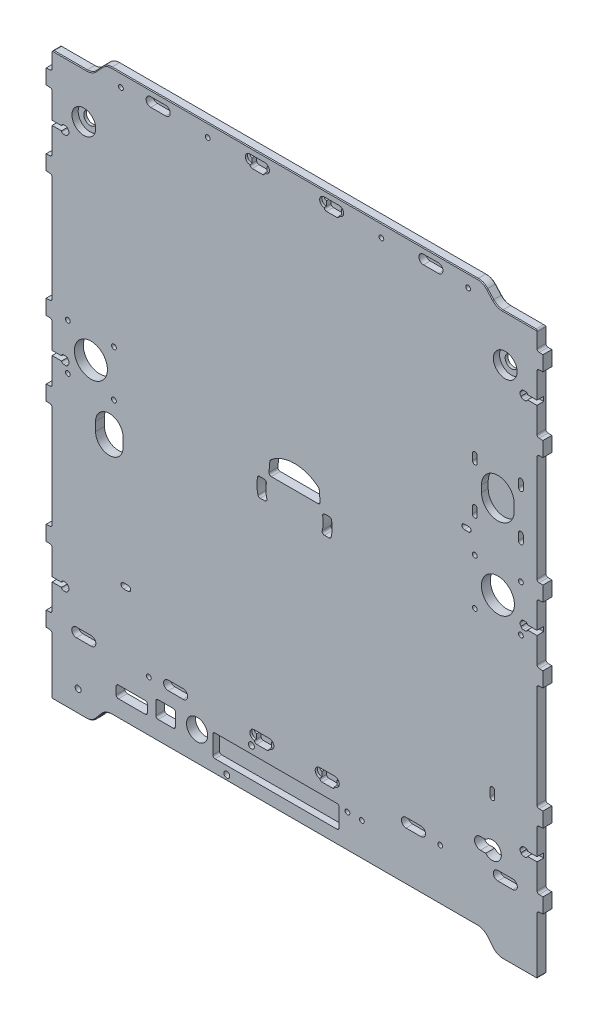
from build123d import *

# Parameters (mm, degrees)
CROQUIS1_W                                           = 334.2
CROQUIS1_H                                           = 388
SALIENTE_EXTRUIR1_DEPTH                              = 6
CORTAR_EXTRUIR1_DEPTH                                = 1.5
CORTAR_EXTRUIR2_DEPTH                                = 3
CORTAR_EXTRUIR3_DEPTH                                = 1.5
CORTAR_EXTRUIR4_DEPTH                                = 3
CROQUIS6_W                                           = 4
CROQUIS6_H                                           = 39.720633844
CORTAR_EXTRUIR5_DEPTH                                = 257.114056623
CROQUIS7_W                                           = 4
CROQUIS7_H                                           = 39.720633844
CORTAR_EXTRUIR6_DEPTH                                = 257.114056623
CROQUIS8_W                                           = 4
CROQUIS8_H                                           = 39.720633844
CORTAR_EXTRUIR7_DEPTH                                = 257.114056623
CORTAR_EXTRUIR8_DEPTH                                = 4.5
CORTAR_EXTRUIR9_DEPTH                                = 4.5
CORTAR_EXTRUIR10_DEPTH                               = 4.5
CROQUIS12_W                                          = 40.15222949
CROQUIS12_H                                          = 10
CORTAR_EXTRUIR11_DEPTH                               = 257.114056623
CROQUIS13_W                                          = 4
CROQUIS13_H                                          = 12.160316922
CORTAR_EXTRUIR12_DEPTH                               = 257.114056623
CROQUIS14_W                                          = 4
CROQUIS14_H                                          = 73.920633844
CORTAR_EXTRUIR13_DEPTH                               = 257.114056623
CROQUIS15_W                                          = 4
CROQUIS15_H                                          = 71.420633844
CORTAR_EXTRUIR14_DEPTH                               = 257.114056623
CROQUIS16_W                                          = 4
CROQUIS16_H                                          = 39.660316922
CORTAR_EXTRUIR15_DEPTH                               = 257.114056623
CROQUIS17_W                                          = 253.89554102
CROQUIS17_H                                          = 10.907202375
CORTAR_EXTRUIR16_DEPTH                               = 257.114056623
CROQUIS18_W                                          = 21
CROQUIS18_H                                          = 8
CORTAR_EXTRUIR17_DEPTH                               = 257.114056623
CROQUIS19_W                                          = 13.2
CROQUIS19_H                                          = 11.5
CORTAR_EXTRUIR18_DEPTH                               = 257.114056623
CORTAR_EXTRUIR19_DEPTH                               = 257.114056623
CORTAR_EXTRUIR20_DEPTH                               = 257.114056623
CORTAR_EXTRUIR21_DEPTH                               = 257.114056623
CORTAR_EXTRUIR22_DEPTH                               = 257.114056623
CORTAR_EXTRUIR23_DEPTH                               = 257.114056623
CORTAR_EXTRUIR24_DEPTH                               = 257.114056623
CORTAR_EXTRUIR25_DEPTH                               = 257.114056623
CORTAR_EXTRUIR26_DEPTH                               = 257.114056623
CORTAR_EXTRUIR27_DEPTH                               = 257.114056623
CORTAR_EXTRUIR28_DEPTH                               = 257.114056623
CORTAR_EXTRUIR29_DEPTH                               = 257.114056623
CORTAR_EXTRUIR30_DEPTH                               = 4.5
CORTAR_EXTRUIR31_DEPTH                               = 4.5
CORTAR_EXTRUIR32_DEPTH                               = 4.5
CORTAR_EXTRUIR33_DEPTH                               = 4.5
CROQUIS36_W                                          = 85
CROQUIS36_H                                          = 15
CORTAR_EXTRUIR34_DEPTH                               = 4.5
NGULO_DE_SALIDA1_ANGLE                               = 2
NGULO_DE_SALIDA2_ANGLE                               = 2
NGULO_DE_SALIDA3_ANGLE                               = 2
NGULO_DE_SALIDA4_ANGLE                               = 2
NGULO_DE_SALIDA5_ANGLE                               = 2
NGULO_DE_SALIDA6_ANGLE                               = 2
NGULO_DE_SALIDA7_ANGLE                               = 2
NGULO_DE_SALIDA8_ANGLE                               = 2
NGULO_DE_SALIDA9_ANGLE                               = 2
NGULO_DE_SALIDA10_ANGLE                              = 2
NGULO_DE_SALIDA11_ANGLE                              = 2
NGULO_DE_SALIDA12_ANGLE                              = 42.465465587
NGULO_DE_SALIDA13_ANGLE                              = 2
NGULO_DE_SALIDA14_ANGLE                              = 2
NGULO_DE_SALIDA15_ANGLE                              = 2
NGULO_DE_SALIDA16_ANGLE                              = 40
CROQUIS37_W                                          = 6
CROQUIS37_H                                          = 6
TALADRO_DE_MARGEN_PARA_M121_D                        = 14.3
TALADRO_DE_MARGEN_PARA_M201_D                        = 22.2
DI_METRO_DE_TALADRO_3_2_3_2_1_D                      = 3.2
DI_METRO_DE_TALADRO_3_2_3_2_2_D                      = 3.2
DI_METRO_DE_TALADRO_4_0_4_1_D                        = 4
DI_METRO_DE_TALADRO_4_0_4_1_DEPTH                    = 4.5
REFRENTADO_PARA_PERNO_CON_CABEZA_HEXAGON_D           = 8.5
REFRENTADO_PARA_PERNO_CON_CABEZA_HEXAGON_CBORE_D     = 16
REFRENTADO_PARA_PERNO_CON_CABEZA_HEXAGON_CBORE_DEPTH = 4.2
REDONDEO1_R                                          = 8.5
CHAFL_N1_SIZE                                        = 0.5
REDONDEO2_R                                          = 1
REDONDEO3_R                                          = 1.5


with BuildPart() as part:
    # Croquis1 → Saliente-Extruir1 (new body)
    with BuildSketch(Plane.XY.offset(3)):
        Rectangle(CROQUIS1_W, CROQUIS1_H)
    extrude(amount=-SALIENTE_EXTRUIR1_DEPTH)

    # Croquis2 → Cortar-Extruir1 (cut)
    with BuildSketch(Plane.XY.offset(3)):
        with BuildLine():
            Line((-17, -151.6), (-17, -150.1))
            ThreePointArc((-17, -150.1), (-13.9, -147), (-17, -143.9))
            Line((-17, -143.9), (-27, -143.9))
            ThreePointArc((-27, -143.9), (-30.1, -147), (-27, -150.1))
            Line((-27, -150.1), (-27, -151.6))
            Line((-27, -151.6), (-17, -151.6))
        make_face()
    cortar_extruir1 = extrude(amount=-CORTAR_EXTRUIR1_DEPTH, mode=Mode.SUBTRACT)

    # Croquis3 → Cortar-Extruir2 (cut)
    with BuildSketch(Plane.XY.offset(1.5)):
        with BuildLine():
            Line((-17, -143.9), (-27, -143.9))
            ThreePointArc((-27, -143.9), (-28.5, -145.4), (-27, -146.9))
            Line((-27, -146.9), (-27, -151.6))
            Line((-27, -151.6), (-17, -151.6))
            Line((-17, -151.6), (-17, -146.9))
            ThreePointArc((-17, -146.9), (-15.5, -145.4), (-17, -143.9))
        make_face()
    cortar_extruir2 = extrude(amount=-CORTAR_EXTRUIR2_DEPTH, mode=Mode.SUBTRACT)

    # Croquis4 → Cortar-Extruir3 (cut)
    with BuildSketch(Plane.XY.offset(3)):
        with BuildLine():
            Line((-20, 182.4), (-20, 183.9))
            ThreePointArc((-20, 183.9), (-16.9, 187), (-20, 190.1))
            Line((-20, 190.1), (-30, 190.1))
            ThreePointArc((-30, 190.1), (-33.1, 187), (-30, 183.9))
            Line((-30, 183.9), (-30, 182.4))
            Line((-30, 182.4), (-20, 182.4))
        make_face()
    cortar_extruir3 = extrude(amount=-CORTAR_EXTRUIR3_DEPTH, mode=Mode.SUBTRACT)

    # Croquis5 → Cortar-Extruir4 (cut)
    with BuildSketch(Plane.XY.offset(1.5)):
        with BuildLine():
            Line((-30, 187.1), (-30, 182.4))
            Line((-30, 182.4), (-20, 182.4))
            Line((-20, 182.4), (-20, 187.1))
            ThreePointArc((-20, 187.1), (-18.5, 188.6), (-20, 190.1))
            Line((-20, 190.1), (-30, 190.1))
            ThreePointArc((-30, 190.1), (-31.5, 188.6), (-30, 187.1))
        make_face()
    cortar_extruir4 = extrude(amount=-CORTAR_EXTRUIR4_DEPTH, mode=Mode.SUBTRACT)

    # Croquis6 → Cortar-Extruir5 (cut, through all)
    with BuildSketch(Plane(origin=(0, 0, -3), x_dir=(-1, 0, 0), z_dir=(0, 0, -1))):
        with Locations((165.1, 141.7)):
            Rectangle(CROQUIS6_W, CROQUIS6_H)
    cortar_extruir5 = extrude(amount=-CORTAR_EXTRUIR5_DEPTH, mode=Mode.SUBTRACT)

    # Croquis7 → Cortar-Extruir6 (cut, through all)
    with BuildSketch(Plane(origin=(0, 0, -3), x_dir=(-1, 0, 0), z_dir=(0, 0, -1))):
        with Locations((165.1, 7.5)):
            Rectangle(CROQUIS7_W, CROQUIS7_H)
    cortar_extruir6 = extrude(amount=-CORTAR_EXTRUIR6_DEPTH, mode=Mode.SUBTRACT)

    # Croquis8 → Cortar-Extruir7 (cut, through all)
    with BuildSketch(Plane(origin=(0, 0, -3), x_dir=(-1, 0, 0), z_dir=(0, 0, -1))):
        with Locations((165.1, -124.2)):
            Rectangle(CROQUIS8_W, CROQUIS8_H)
    cortar_extruir7 = extrude(amount=-CORTAR_EXTRUIR7_DEPTH, mode=Mode.SUBTRACT)

    # Croquis9 → Cortar-Extruir8 (cut)
    with BuildSketch(Plane.XY.offset(3)):
        with BuildLine():
            Line((-163.1, -125.8), (-156.779019946, -125.8))
            ThreePointArc((-156.779019946, -125.8), (-156.268245837, -126.695643924), (-155.3, -127.05))
            Line((-155.3, -127.05), (-153.9, -127.05))
            ThreePointArc((-153.9, -127.05), (-152.931754163, -126.695643924), (-152.420980054, -125.8))
            Line((-152.420980054, -125.8), (-152.420980054, -125.637509594))
            ThreePointArc((-152.420980054, -125.637509594), (-151.6, -124.3), (-152.420980054, -122.962490406))
            Line((-152.420980054, -122.962490406), (-152.420980054, -122.8))
            ThreePointArc((-152.420980054, -122.8), (-152.931754163, -121.904356076), (-153.9, -121.55))
            Line((-153.9, -121.55), (-155.3, -121.55))
            ThreePointArc((-155.3, -121.55), (-156.268245837, -121.904356076), (-156.779019946, -122.8))
            Line((-156.779019946, -122.8), (-163.1, -122.8))
            Line((-163.1, -122.8), (-163.1, -125.8))
        make_face()
    cortar_extruir8 = extrude(amount=-CORTAR_EXTRUIR8_DEPTH, mode=Mode.SUBTRACT)

    # Croquis10 → Cortar-Extruir9 (cut)
    with BuildSketch(Plane.XY.offset(3)):
        with BuildLine():
            Line((-163.1, 6.1), (-156.779454737, 6.1))
            ThreePointArc((-156.779454737, 6.1), (-156.268680627, 5.204356076), (-155.300434791, 4.85))
            Line((-155.300434791, 4.85), (-153.900434791, 4.85))
            ThreePointArc((-153.900434791, 4.85), (-152.932188954, 5.204356076), (-152.421414845, 6.1))
            Line((-152.421414845, 6.1), (-152.421414845, 6.262490406))
            ThreePointArc((-152.421414845, 6.262490406), (-151.600434791, 7.6), (-152.421414845, 8.937509594))
            Line((-152.421414845, 8.937509594), (-152.421414845, 9.1))
            ThreePointArc((-152.421414845, 9.1), (-152.932188954, 9.995643924), (-153.900434791, 10.35))
            Line((-153.900434791, 10.35), (-155.300434791, 10.35))
            ThreePointArc((-155.300434791, 10.35), (-156.268680627, 9.995643924), (-156.779454737, 9.1))
            Line((-156.779454737, 9.1), (-163.1, 9.1))
            Line((-163.1, 9.1), (-163.1, 6.1))
        make_face()
    cortar_extruir9 = extrude(amount=-CORTAR_EXTRUIR9_DEPTH, mode=Mode.SUBTRACT)

    # Croquis11 → Cortar-Extruir10 (cut)
    with BuildSketch(Plane.XY.offset(3)):
        with BuildLine():
            Line((-163.1, 140.2), (-156.779019946, 140.2))
            ThreePointArc((-156.779019946, 140.2), (-156.268245837, 139.304356076), (-155.3, 138.95))
            Line((-155.3, 138.95), (-153.9, 138.95))
            ThreePointArc((-153.9, 138.95), (-152.931754163, 139.304356076), (-152.420980054, 140.2))
            Line((-152.420980054, 140.2), (-152.420980054, 140.362490406))
            ThreePointArc((-152.420980054, 140.362490406), (-151.6, 141.7), (-152.420980054, 143.037509594))
            Line((-152.420980054, 143.037509594), (-152.420980054, 143.2))
            ThreePointArc((-152.420980054, 143.2), (-152.931754163, 144.095643924), (-153.9, 144.45))
            Line((-153.9, 144.45), (-155.3, 144.45))
            ThreePointArc((-155.3, 144.45), (-156.268245837, 144.095643924), (-156.779019946, 143.2))
            Line((-156.779019946, 143.2), (-163.1, 143.2))
            Line((-163.1, 143.2), (-163.1, 140.2))
        make_face()
    cortar_extruir10 = extrude(amount=-CORTAR_EXTRUIR10_DEPTH, mode=Mode.SUBTRACT)

    # Croquis12 → Cortar-Extruir11 (cut, through all)
    with BuildSketch(Plane(origin=(0, 0, -3), x_dir=(-1, 0, 0), z_dir=(0, 0, -1))):
        with Locations((147.023885255, 189)):
            Rectangle(CROQUIS12_W, CROQUIS12_H)
    cortar_extruir11 = extrude(amount=-CORTAR_EXTRUIR11_DEPTH, mode=Mode.SUBTRACT)

    # Croquis13 → Cortar-Extruir12 (cut, through all)
    with BuildSketch(Plane(origin=(0, 0, -3), x_dir=(-1, 0, 0), z_dir=(0, 0, -1))):
        with Locations((165.1, 177.919841539)):
            Rectangle(CROQUIS13_W, CROQUIS13_H)
    cortar_extruir12 = extrude(amount=-CORTAR_EXTRUIR12_DEPTH, mode=Mode.SUBTRACT)

    # Croquis14 → Cortar-Extruir13 (cut, through all)
    with BuildSketch(Plane(origin=(0, 0, -3), x_dir=(-1, 0, 0), z_dir=(0, 0, -1))):
        with Locations((165.1, 74.6)):
            Rectangle(CROQUIS14_W, CROQUIS14_H)
    cortar_extruir13 = extrude(amount=-CORTAR_EXTRUIR13_DEPTH, mode=Mode.SUBTRACT)

    # Croquis15 → Cortar-Extruir14 (cut, through all)
    with BuildSketch(Plane(origin=(0, 0, -3), x_dir=(-1, 0, 0), z_dir=(0, 0, -1))):
        with Locations((165.1, -58.35)):
            Rectangle(CROQUIS15_W, CROQUIS15_H)
    cortar_extruir14 = extrude(amount=-CORTAR_EXTRUIR14_DEPTH, mode=Mode.SUBTRACT)

    # Croquis16 → Cortar-Extruir15 (cut, through all)
    with BuildSketch(Plane(origin=(0, 0, -3), x_dir=(-1, 0, 0), z_dir=(0, 0, -1))):
        with Locations((165.1, -174.169841539)):
            Rectangle(CROQUIS16_W, CROQUIS16_H)
    cortar_extruir15 = extrude(amount=-CORTAR_EXTRUIR15_DEPTH, mode=Mode.SUBTRACT)

    # Croquis17 → Cortar-Extruir16 (cut, through all)
    with BuildSketch(Plane(origin=(0, 0, -3), x_dir=(-1, 0, 0), z_dir=(0, 0, -1))):
        with Locations((0, -188.546398813)):
            Rectangle(CROQUIS17_W, CROQUIS17_H)
    extrude(amount=-CORTAR_EXTRUIR16_DEPTH, mode=Mode.SUBTRACT)

    # Croquis18 → Cortar-Extruir17 (cut, through all)
    with BuildSketch(Plane.XY.offset(3)):
        with Locations((-109.53, -167.55)):
            Rectangle(CROQUIS18_W, CROQUIS18_H)
    extrude(amount=-CORTAR_EXTRUIR17_DEPTH, mode=Mode.SUBTRACT)

    # Croquis19 → Cortar-Extruir18 (cut, through all)
    with BuildSketch(Plane.XY.offset(3)):
        with Locations((-86.75, -164.5)):
            Rectangle(CROQUIS19_W, CROQUIS19_H)
    extrude(amount=-CORTAR_EXTRUIR18_DEPTH, mode=Mode.SUBTRACT)

    # Croquis20 → Cortar-Extruir19 (cut, through all)
    with BuildSketch(Plane.XY.offset(3)):
        with BuildLine():
            Line((153.884643176, 55.25), (153.884643176, 59.75))
            ThreePointArc((153.884643176, 59.75), (152.284643176, 61.35), (150.684643176, 59.75))
            Line((150.684643176, 59.75), (150.684643176, 55.25))
            ThreePointArc((150.684643176, 55.25), (152.284643176, 53.65), (153.884643176, 55.25))
        make_face()
    extrude(amount=-CORTAR_EXTRUIR19_DEPTH, mode=Mode.SUBTRACT)

    # Croquis21 → Cortar-Extruir20 (cut, through all)
    with BuildSketch(Plane.XY.offset(3)):
        with BuildLine():
            Line((150.684643176, 90.75), (150.684643176, 86.25))
            ThreePointArc((150.684643176, 86.25), (152.284643176, 84.65), (153.884643176, 86.25))
            Line((153.884643176, 86.25), (153.884643176, 90.75))
            ThreePointArc((153.884643176, 90.75), (152.284643176, 92.35), (150.684643176, 90.75))
        make_face()
    extrude(amount=-CORTAR_EXTRUIR20_DEPTH, mode=Mode.SUBTRACT)

    # Croquis22 → Cortar-Extruir21 (cut, through all)
    with BuildSketch(Plane.XY.offset(3)):
        with BuildLine():
            Line((122.884643176, 55.25), (122.884643176, 59.75))
            ThreePointArc((122.884643176, 59.75), (121.284643176, 61.35), (119.684643176, 59.75))
            Line((119.684643176, 59.75), (119.684643176, 55.25))
            ThreePointArc((119.684643176, 55.25), (121.284643176, 53.65), (122.884643176, 55.25))
        make_face()
    extrude(amount=-CORTAR_EXTRUIR21_DEPTH, mode=Mode.SUBTRACT)

    # Croquis23 → Cortar-Extruir22 (cut, through all)
    with BuildSketch(Plane.XY.offset(3)):
        with BuildLine():
            Line((119.684643176, 90.75), (119.684643176, 86.25))
            ThreePointArc((119.684643176, 86.25), (121.284643176, 84.65), (122.884643176, 86.25))
            Line((122.884643176, 86.25), (122.884643176, 90.75))
            ThreePointArc((122.884643176, 90.75), (121.284643176, 92.35), (119.684643176, 90.75))
        make_face()
    extrude(amount=-CORTAR_EXTRUIR22_DEPTH, mode=Mode.SUBTRACT)

    # Croquis24 → Cortar-Extruir23 (cut, through all)
    with BuildSketch(Plane.XY.offset(3)):
        with BuildLine():
            Line((-133.85, -17.6), (-133.85, -23.6))
            ThreePointArc((-133.85, -23.6), (-124.6, -32.85), (-115.35, -23.6))
            Line((-115.35, -23.6), (-115.35, -17.6))
            ThreePointArc((-115.35, -17.6), (-124.6, -8.35), (-133.85, -17.6))
        make_face()
    extrude(amount=-CORTAR_EXTRUIR23_DEPTH, mode=Mode.SUBTRACT)

    # Croquis25 → Cortar-Extruir24 (cut, through all)
    with BuildSketch(Plane.XY.offset(3)):
        with BuildLine():
            Line((-17.345934449, 9.29641835), (17.345934449, 9.29641835))
            Line((17.345934449, 9.29641835), (16.54324975, 18.471146441))
            ThreePointArc((16.54324975, 18.471146441), (0, 24.796418353), (-16.54324975, 18.471146441))
            Line((-16.54324975, 18.471146441), (-17.345934449, 9.29641835))
        make_face()
    extrude(amount=-CORTAR_EXTRUIR24_DEPTH, mode=Mode.SUBTRACT)

    # Croquis26 → Cortar-Extruir25 (cut, through all)
    with BuildSketch(Plane.XY.offset(3)):
        with BuildLine():
            Line((-24.308615376, -7), (-20.055947156, -7))
            ThreePointArc((-20.055947156, -7), (-18.863249712, -6.409655323), (-18.609355718, -5.103297075))
            ThreePointArc((-18.609355718, -5.103297075), (-19.295315628, 0.206291233), (-18.495993114, 5.5))
            Line((-18.495993114, 5.5), (-24.691269338, 5.5))
            ThreePointArc((-24.691269338, 5.5), (-25.284573864, -0.774019388), (-24.308615376, -7))
        make_face()
    cortar_extruir25 = extrude(amount=-CORTAR_EXTRUIR25_DEPTH, mode=Mode.SUBTRACT)

    # Croquis27 → Cortar-Extruir26 (cut, through all)
    with BuildSketch(Plane.XY.offset(3)):
        with BuildLine():
            Line((125.1, -138), (128.627864045, -138))
            ThreePointArc((128.627864045, -138), (127.1, -134), (128.627864045, -130))
            Line((128.627864045, -130), (125.1, -130))
            ThreePointArc((125.1, -130), (121.1, -134), (125.1, -138))
        make_face()
    extrude(amount=-CORTAR_EXTRUIR26_DEPTH, mode=Mode.SUBTRACT)

    # Croquis28 → Cortar-Extruir27 (cut, through all)
    with BuildSketch(Plane.XY.offset(3)):
        with BuildLine():
            Line((131.6, -98.5), (131.6, -103.5))
            ThreePointArc((131.6, -103.5), (133.1, -105), (134.6, -103.5))
            Line((134.6, -103.5), (134.6, -98.5))
            ThreePointArc((134.6, -98.5), (133.1, -97), (131.6, -98.5))
        make_face()
    extrude(amount=-CORTAR_EXTRUIR27_DEPTH, mode=Mode.SUBTRACT)

    # Croquis29 → Cortar-Extruir28 (cut, through all)
    with BuildSketch(Plane.XY.offset(3)):
        with BuildLine():
            Line((114.128932188, 43.4), (117.128932188, 43.4))
            ThreePointArc((117.128932188, 43.4), (118.728932188, 45), (117.128932188, 46.6))
            Line((117.128932188, 46.6), (114.128932188, 46.6))
            ThreePointArc((114.128932188, 46.6), (112.528932188, 45), (114.128932188, 43.4))
        make_face()
    extrude(amount=-CORTAR_EXTRUIR28_DEPTH, mode=Mode.SUBTRACT)

    # Croquis30 → Cortar-Extruir29 (cut, through all)
    with BuildSketch(Plane(origin=(0, 0, -3), x_dir=(-1, 0, 0), z_dir=(0, 0, -1))):
        with BuildLine():
            Line((115, -102.25), (112, -102.25))
            ThreePointArc((112, -102.25), (110.25, -104), (112, -105.75))
            Line((112, -105.75), (115, -105.75))
            ThreePointArc((115, -105.75), (116.75, -104), (115, -102.25))
        make_face()
    extrude(amount=-CORTAR_EXTRUIR29_DEPTH, mode=Mode.SUBTRACT)

    # Croquis31 → Cortar-Extruir30 (cut)
    with BuildSketch(Plane.XY.offset(3)):
        with BuildLine():
            Line((147.784643176, 70.75), (147.784643176, 75.25))
            ThreePointArc((147.784643176, 75.25), (136.784643176, 86.25), (125.784643176, 75.25))
            Line((125.784643176, 75.25), (125.784643176, 70.75))
            ThreePointArc((125.784643176, 70.75), (136.784643176, 59.75), (147.784643176, 70.75))
        make_face()
    extrude(amount=-CORTAR_EXTRUIR30_DEPTH, mode=Mode.SUBTRACT)

    # Croquis32 → Cortar-Extruir31 (cut)
    with BuildSketch(Plane.XY.offset(3)):
        with BuildLine():
            Line((-75, -143.9), (-85, -143.9))
            ThreePointArc((-85, -143.9), (-88.1, -147), (-85, -150.1))
            Line((-85, -150.1), (-75, -150.1))
            ThreePointArc((-75, -150.1), (-71.9, -147), (-75, -143.9))
        make_face()
    cortar_extruir31 = extrude(amount=-CORTAR_EXTRUIR31_DEPTH, mode=Mode.SUBTRACT)

    # Croquis33 → Cortar-Extruir32 (cut)
    with BuildSketch(Plane.XY.offset(3)):
        with BuildLine():
            Line((-146.8, -150.1), (-136.8, -150.1))
            ThreePointArc((-136.8, -150.1), (-133.7, -147), (-136.8, -143.9))
            Line((-136.8, -143.9), (-146.8, -143.9))
            ThreePointArc((-146.8, -143.9), (-149.9, -147), (-146.8, -150.1))
        make_face()
    cortar_extruir32 = extrude(amount=-CORTAR_EXTRUIR32_DEPTH, mode=Mode.SUBTRACT)

    # Croquis34 → Cortar-Extruir33 (cut)
    with BuildSketch(Plane.XY.offset(3)):
        with BuildLine():
            Line((-86.75, 190.1), (-96.75, 190.1))
            ThreePointArc((-96.75, 190.1), (-99.85, 187), (-96.75, 183.9))
            Line((-96.75, 183.9), (-86.75, 183.9))
            ThreePointArc((-86.75, 183.9), (-83.65, 187), (-86.75, 190.1))
        make_face()
    cortar_extruir33 = extrude(amount=-CORTAR_EXTRUIR33_DEPTH, mode=Mode.SUBTRACT)

    # Simetría1: Cortar-Extruir1, Cortar-Extruir2, Cortar-Extruir3, Cortar-Extruir4, Cortar-Extruir5, Cortar-Extruir6, Cortar-Extruir7, Cortar-Extruir8, Cortar-Extruir9, Cortar-Extruir10, Cortar-Extruir11, Cortar-Extruir12, Cortar-Extruir13, Cortar-Extruir14, Cortar-Extruir15, Cortar-Extruir25, Cortar-Extruir31, Cortar-Extruir32, Cortar-Extruir33 across plane
    add(cortar_extruir1.mirror(Plane(origin=(0, 0, 0), x_dir=(0, 0, 1), z_dir=(1, 0, 0))), mode=Mode.SUBTRACT)
    add(cortar_extruir2.mirror(Plane(origin=(0, 0, 0), x_dir=(0, 0, 1), z_dir=(1, 0, 0))), mode=Mode.SUBTRACT)
    add(cortar_extruir3.mirror(Plane(origin=(0, 0, 0), x_dir=(0, 0, 1), z_dir=(1, 0, 0))), mode=Mode.SUBTRACT)
    add(cortar_extruir4.mirror(Plane(origin=(0, 0, 0), x_dir=(0, 0, 1), z_dir=(1, 0, 0))), mode=Mode.SUBTRACT)
    add(cortar_extruir5.mirror(Plane(origin=(0, 0, 0), x_dir=(0, 0, 1), z_dir=(1, 0, 0))), mode=Mode.SUBTRACT)
    add(cortar_extruir6.mirror(Plane(origin=(0, 0, 0), x_dir=(0, 0, 1), z_dir=(1, 0, 0))), mode=Mode.SUBTRACT)
    add(cortar_extruir7.mirror(Plane(origin=(0, 0, 0), x_dir=(0, 0, 1), z_dir=(1, 0, 0))), mode=Mode.SUBTRACT)
    add(cortar_extruir8.mirror(Plane(origin=(0, 0, 0), x_dir=(0, 0, 1), z_dir=(1, 0, 0))), mode=Mode.SUBTRACT)
    add(cortar_extruir9.mirror(Plane(origin=(0, 0, 0), x_dir=(0, 0, 1), z_dir=(1, 0, 0))), mode=Mode.SUBTRACT)
    add(cortar_extruir10.mirror(Plane(origin=(0, 0, 0), x_dir=(0, 0, 1), z_dir=(1, 0, 0))), mode=Mode.SUBTRACT)
    add(cortar_extruir11.mirror(Plane(origin=(0, 0, 0), x_dir=(0, 0, 1), z_dir=(1, 0, 0))), mode=Mode.SUBTRACT)
    add(cortar_extruir12.mirror(Plane(origin=(0, 0, 0), x_dir=(0, 0, 1), z_dir=(1, 0, 0))), mode=Mode.SUBTRACT)
    add(cortar_extruir13.mirror(Plane(origin=(0, 0, 0), x_dir=(0, 0, 1), z_dir=(1, 0, 0))), mode=Mode.SUBTRACT)
    add(cortar_extruir14.mirror(Plane(origin=(0, 0, 0), x_dir=(0, 0, 1), z_dir=(1, 0, 0))), mode=Mode.SUBTRACT)
    add(cortar_extruir15.mirror(Plane(origin=(0, 0, 0), x_dir=(0, 0, 1), z_dir=(1, 0, 0))), mode=Mode.SUBTRACT)
    add(cortar_extruir25.mirror(Plane(origin=(0, 0, 0), x_dir=(0, 0, 1), z_dir=(1, 0, 0))), mode=Mode.SUBTRACT)
    add(cortar_extruir31.mirror(Plane(origin=(0, 0, 0), x_dir=(0, 0, 1), z_dir=(1, 0, 0))), mode=Mode.SUBTRACT)
    add(cortar_extruir32.mirror(Plane(origin=(0, 0, 0), x_dir=(0, 0, 1), z_dir=(1, 0, 0))), mode=Mode.SUBTRACT)
    add(cortar_extruir33.mirror(Plane(origin=(0, 0, 0), x_dir=(0, 0, 1), z_dir=(1, 0, 0))), mode=Mode.SUBTRACT)

    # Croquis36 → Cortar-Extruir34 (cut)
    with BuildSketch(Plane.XY.offset(3)):
        with Locations((-12.5, -166.5)):
            Rectangle(CROQUIS36_W, CROQUIS36_H)
    extrude(amount=-CORTAR_EXTRUIR34_DEPTH, mode=Mode.SUBTRACT)

    # Ángulo de salida1
    ngulo_de_salida1_faces = [part.faces().sort_by_distance(p)[0] for p in [
        (165.1, -154.339683078, 0),
    ]]
    draft(ngulo_de_salida1_faces, Plane(origin=(163.1, -154.339683078, 3.000025), x_dir=(0, 0, 1), z_dir=(1, 0, 0)), NGULO_DE_SALIDA1_ANGLE)

    # Ángulo de salida2
    ngulo_de_salida2_faces = [part.faces().sort_by_distance(p)[0] for p in [
        (165.1, 171.839683078, 0),
    ]]
    draft(ngulo_de_salida2_faces, Plane(origin=(163.1, 184, 3.000025), x_dir=(0, 0, 1), z_dir=(1, 0, 0)), NGULO_DE_SALIDA2_ANGLE)

    # Ángulo de salida3
    ngulo_de_salida3_faces = [part.faces().sort_by_distance(p)[0] for p in [
        (-165.1, 171.839683078, 0),
    ]]
    draft(ngulo_de_salida3_faces, Plane(origin=(-163.1, 184, 3.000025), x_dir=(0, 0, -1), z_dir=(-1, 0, 0)), NGULO_DE_SALIDA3_ANGLE)

    # Ángulo de salida4
    ngulo_de_salida4_faces = [part.faces().sort_by_distance(p)[0] for p in [
        (-165.1, -154.339683078, 0),
    ]]
    draft(ngulo_de_salida4_faces, Plane(origin=(-163.1, -154.339683078, 3.000025), x_dir=(0, 0, -1), z_dir=(-1, 0, 0)), NGULO_DE_SALIDA4_ANGLE)

    # Ángulo de salida5
    ngulo_de_salida5_faces = [part.faces().sort_by_distance(p)[0] for p in [
        (165.1, -94.060316922, 0),
        (165.1, -22.639683078, 0),
    ]]
    draft(ngulo_de_salida5_faces, Plane(origin=(163.1, -22.639683078, 3.000025), x_dir=(0, 0, 1), z_dir=(1, 0, 0)), NGULO_DE_SALIDA5_ANGLE)

    # Ángulo de salida6
    ngulo_de_salida6_faces = [part.faces().sort_by_distance(p)[0] for p in [
        (165.1, 37.639683078, 0),
        (165.1, 111.560316922, 0),
    ]]
    draft(ngulo_de_salida6_faces, Plane(origin=(163.1, 111.560316922, 3.000025), x_dir=(0, 1, 0), z_dir=(1, 0, 0)), NGULO_DE_SALIDA6_ANGLE)

    # Ángulo de salida7
    ngulo_de_salida7_faces = [part.faces().sort_by_distance(p)[0] for p in [
        (-165.1, 111.560316922, 0),
        (-165.1, 37.639683078, 0),
    ]]
    draft(ngulo_de_salida7_faces, Plane(origin=(-163.1, 111.560316922, 3.000025), x_dir=(0, -1, 0), z_dir=(-1, 0, 0)), NGULO_DE_SALIDA7_ANGLE)

    # Ángulo de salida8
    ngulo_de_salida8_faces = [part.faces().sort_by_distance(p)[0] for p in [
        (-165.1, -22.639683078, 0),
        (-165.1, -94.060316922, 0),
    ]]
    draft(ngulo_de_salida8_faces, Plane(origin=(-163.1, -22.639683078, 3.000025), x_dir=(0, 0, -1), z_dir=(-1, 0, 0)), NGULO_DE_SALIDA8_ANGLE)

    # Ángulo de salida9
    ngulo_de_salida9_faces = [part.faces().sort_by_distance(p)[0] for p in [
        (165.1, -144.060316922, 0),
        (165.1, -104.339683078, 0),
    ]]
    draft(ngulo_de_salida9_faces, Plane(origin=(163.1, -104.339683078, 3.000025), x_dir=(0, 0, 1), z_dir=(1, 0, 0)), NGULO_DE_SALIDA9_ANGLE)

    # Ángulo de salida10
    ngulo_de_salida10_faces = [part.faces().sort_by_distance(p)[0] for p in [
        (165.1, -12.360316922, 0),
        (165.1, 27.360316922, 0),
    ]]
    draft(ngulo_de_salida10_faces, Plane(origin=(163.1, 27.360316922, 3.000025), x_dir=(0, 0, 1), z_dir=(1, 0, 0)), NGULO_DE_SALIDA10_ANGLE)

    # Ángulo de salida11
    ngulo_de_salida11_faces = [part.faces().sort_by_distance(p)[0] for p in [
        (165.1, 121.839683078, 0),
        (165.1, 161.560316922, 0),
    ]]
    draft(ngulo_de_salida11_faces, Plane(origin=(163.1, 161.560316922, 3.000025), x_dir=(0, 1, 0), z_dir=(1, 0, 0)), NGULO_DE_SALIDA11_ANGLE)

    # Ángulo de salida12
    ngulo_de_salida12_faces = [part.faces().sort_by_distance(p)[0] for p in [
        (126.94777051, 189, 0),
        (-126.94777051, 189, 0),
    ]]
    draft(ngulo_de_salida12_faces, Plane(origin=(167.1, 194, -3), x_dir=(0, 0, 1), z_dir=(0, 1, 0)), NGULO_DE_SALIDA12_ANGLE)

    # Ángulo de salida13
    ngulo_de_salida13_faces = [part.faces().sort_by_distance(p)[0] for p in [
        (-165.1, 161.560316922, 0),
        (-165.1, 121.839683078, 0),
    ]]
    draft(ngulo_de_salida13_faces, Plane(origin=(-163.1, 161.560316922, 3.000025), x_dir=(0, -1, 0), z_dir=(-1, 0, 0)), NGULO_DE_SALIDA13_ANGLE)

    # Ángulo de salida14
    ngulo_de_salida14_faces = [part.faces().sort_by_distance(p)[0] for p in [
        (-165.1, 27.360316922, 0),
        (-165.1, -12.360316922, 0),
    ]]
    draft(ngulo_de_salida14_faces, Plane(origin=(-163.1, 27.360316922, 3.000025), x_dir=(0, 0, -1), z_dir=(-1, 0, 0)), NGULO_DE_SALIDA14_ANGLE)

    # Ángulo de salida15
    ngulo_de_salida15_faces = [part.faces().sort_by_distance(p)[0] for p in [
        (-165.1, -104.339683078, 0),
        (-165.1, -144.060316922, 0),
    ]]
    draft(ngulo_de_salida15_faces, Plane(origin=(-163.1, -104.339683078, 3.000025), x_dir=(0, 0, -1), z_dir=(-1, 0, 0)), NGULO_DE_SALIDA15_ANGLE)

    # Ángulo de salida16
    ngulo_de_salida16_faces = [part.faces().sort_by_distance(p)[0] for p in [
        (126.94777051, -188.546398812, 0),
        (-126.94777051, -188.546398812, 0),
    ]]
    draft(ngulo_de_salida16_faces, Plane(origin=(-126.94777051, -183.092797625, 3.000025), x_dir=(0, 0, -1), z_dir=(0, -1, 0)), NGULO_DE_SALIDA16_ANGLE)

    # Croquis37 → Cortar-Revolución1 (revolve, cut)
    with BuildSketch(Plane(origin=(0, -134, 0), x_dir=(1, 0, 0), z_dir=(0, 1, 0))):
        with Locations((136.1, 0)):
            Rectangle(CROQUIS37_W, CROQUIS37_H)
    revolve(axis=Axis((133.1, -134, -3), (0, 0, 1)), mode=Mode.SUBTRACT)

    # Taladro de margen para M121 (through all)
    with Locations(Plane(origin=(0, 0, -3), x_dir=(-1, 0, 0), z_dir=(0, 0, -1))):
        with Locations((65.55, -163)):
            Hole(TALADRO_DE_MARGEN_PARA_M121_D / 2)

    # Taladro de margen para M201 (through all)
    with Locations(Plane(origin=(0, 0, -3), x_dir=(-1, 0, 0), z_dir=(0, 0, -1))):
        with Locations((137, 16.5), (-136.796531281, 16.5)):
            Hole(TALADRO_DE_MARGEN_PARA_M201_D / 2)

    # Diámetro de taladro Ø3.2 (3.2)1 (through all)
    with Locations(Plane.XY.offset(3)):
        with Locations((98, -148.55), (116.8, 185.45), (58.43902163, 185.45)):
            Hole(DI_METRO_DE_TALADRO_3_2_3_2_1_D / 2)

    # Diámetro de taladro Ø3.2 (3.2)2 (through all)
    with Locations(Plane(origin=(0, 0, -3), x_dir=(-1, 0, 0), z_dir=(0, 0, -1))):
        with Locations((-121.296531281, 1), (-152.296531281, 32), (98, -148.55), (116.8, 185.45), (58.43902163, 185.45), (121.5, 32), (152.5, 32), (152.5, 1), (121.5, 1), (-35.6, -160.5), (-45.3, -160.5), (-121.296531281, 32), (-152.296531281, 1)):
            Hole(DI_METRO_DE_TALADRO_3_2_3_2_2_D / 2)

    # Diámetro de taladro Ø4.0 (4)1
    with Locations(Plane.XY.offset(3)):
        with Locations((-145.6, -179.3), (-29, -154), (-45.6, -179.3)):
            Hole(DI_METRO_DE_TALADRO_4_0_4_1_D / 2, depth=DI_METRO_DE_TALADRO_4_0_4_1_DEPTH)

    # Refrentado para perno con cabeza hexagonal de M81 (through all)
    with Locations(Plane.XY.offset(3)):
        with Locations((141.75, 153), (-141.75, 153)):
            CounterBoreHole(REFRENTADO_PARA_PERNO_CON_CABEZA_HEXAGON_D / 2, REFRENTADO_PARA_PERNO_CON_CABEZA_HEXAGON_CBORE_D / 2, REFRENTADO_PARA_PERNO_CON_CABEZA_HEXAGON_CBORE_DEPTH)

    # Redondeo1
    redondeo1_edges = [part.edges().sort_by_distance(p)[0] for p in [
        (-126.94777051, 194, 0),
        (-136.1, 184, 0),
        (-136.1, -194, 0),
        (136.1, -194, 0),
        (126.94777051, -183.092797625, 0),
        (-126.94777051, -183.092797625, 0),
        (126.94777051, 194, 0),
        (136.1, 184, 0),
    ]]
    fillet(redondeo1_edges, radius=REDONDEO1_R)

    # Chaflán1
    chafl_n1_edges = [part.edges().sort_by_distance(p)[0] for p in [
        (0, -183.092797625, 3),
        (0, -183.092797625, -3),
        (-131.523885255, -188.546398812, 3),
        (-131.523885255, -188.546398812, -3),
        (151.581807547, -194, -3),
        (151.581807547, -194, 3),
        (131.523885255, -188.546398812, -3),
        (-151.471573759, 184, -3),
        (-131.523885255, 189, -3),
        (0, 194, -3),
        (131.523885255, 189, -3),
        (151.471573759, 184, -3),
        (-126.6303144, 193.279115527, -3),
        (-136.47135987, -193.20361619, -3),
        (126.6303144, 193.279115527, -3),
        (136.47135987, -193.20361619, -3),
        (131.523885255, -188.546398812, 3),
        (131.523885255, 189, 3),
        (0, 194, 3),
        (-131.523885255, 189, 3),
        (-126.6303144, 193.279115527, 3),
        (-136.47135987, -193.20361619, 3),
        (126.6303144, 193.279115527, 3),
        (136.47135987, -193.20361619, 3),
        (-126.57641064, -183.889181435, -3),
        (-126.57641064, -183.889181435, 3),
        (126.57641064, -183.889181435, -3),
        (126.57641064, -183.889181435, 3),
        (-136.417456109, 184.720884473, -3),
        (-136.417456109, 184.720884473, 3),
        (136.417456109, 184.720884473, -3),
        (136.417456109, 184.720884473, 3),
        (-151.471573759, 184, 3),
        (-151.581807547, -194, 3),
        (-151.581807547, -194, -3),
        (151.471573759, 184, 3),
    ]]
    chamfer(chafl_n1_edges, length=CHAFL_N1_SIZE)

    # Redondeo2
    redondeo2_edges = [part.edges().sort_by_distance(p)[0] for p in [
        (-163.1, 184, 0),
        (-163.1, -194, 0),
        (163.1, 184, 0),
        (163.1, -194, 0),
    ]]
    fillet(redondeo2_edges, radius=REDONDEO2_R)

    # Redondeo3
    redondeo3_edges = [part.edges().sort_by_distance(p)[0] for p in [
        (-55, -159, 0.75),
        (30, -159, 0.75),
        (30, -174, 0.75),
        (-55, -174, 0.75),
        (-163.1, 121.839683078, 0),
        (-163.1, 161.560316922, 0),
        (-163.1, -12.360316922, 0),
        (-163.1, 27.360316922, 0),
        (-163.1, -144.060316922, 0),
        (-163.1, -104.339683078, 0),
        (-17, -151.6, 0.75),
        (-27, -151.6, 0.75),
        (-163.1, 171.839683078, 0),
        (-163.1, 37.639683078, 0),
        (-163.1, 111.560316922, 0),
        (-163.1, -94.060316922, 0),
        (-163.1, -22.639683078, 0),
        (-163.1, -154.339683078, 0),
        (-99.03, -171.55, 0),
        (-120.03, -171.55, 0),
        (-120.03, -163.55, 0),
        (-99.03, -163.55, 0),
        (-80.15, -170.25, 0),
        (-93.35, -170.25, 0),
        (-93.35, -158.75, 0),
        (-80.15, -158.75, 0),
        (-17.345934449, 9.29641835, 0),
        (-16.54324975, 18.471146441, 0),
        (16.54324975, 18.471146441, 0),
        (17.345934449, 9.29641835, 0),
        (-24.308615376, -7, 0),
        (-24.691269338, 5.5, 0),
        (-18.495993114, 5.5, 0),
        (-20, 182.4, 0.75),
        (-30, 182.4, 0.75),
        (27, -151.6, 0.75),
        (17, -151.6, 0.75),
        (30, 182.4, 0.75),
        (20, 182.4, 0.75),
        (163.1, 121.839683078, 0),
        (163.1, 161.560316922, 0),
        (163.1, -12.360316922, 0),
        (163.1, 27.360316922, 0),
        (163.1, -144.060316922, 0),
        (163.1, -104.339683078, 0),
        (163.1, 171.839683078, 0),
        (163.1, 37.639683078, 0),
        (163.1, 111.560316922, 0),
        (163.1, -94.060316922, 0),
        (163.1, -22.639683078, 0),
        (163.1, -154.339683078, 0),
        (24.691269338, 5.5, 0),
        (24.308615376, -7, 0),
        (18.495993114, 5.5, 0),
    ]]
    fillet(redondeo3_edges, radius=REDONDEO3_R - 0.0001)  # a hair under: the kernel refuses the full size


solid = part.part
